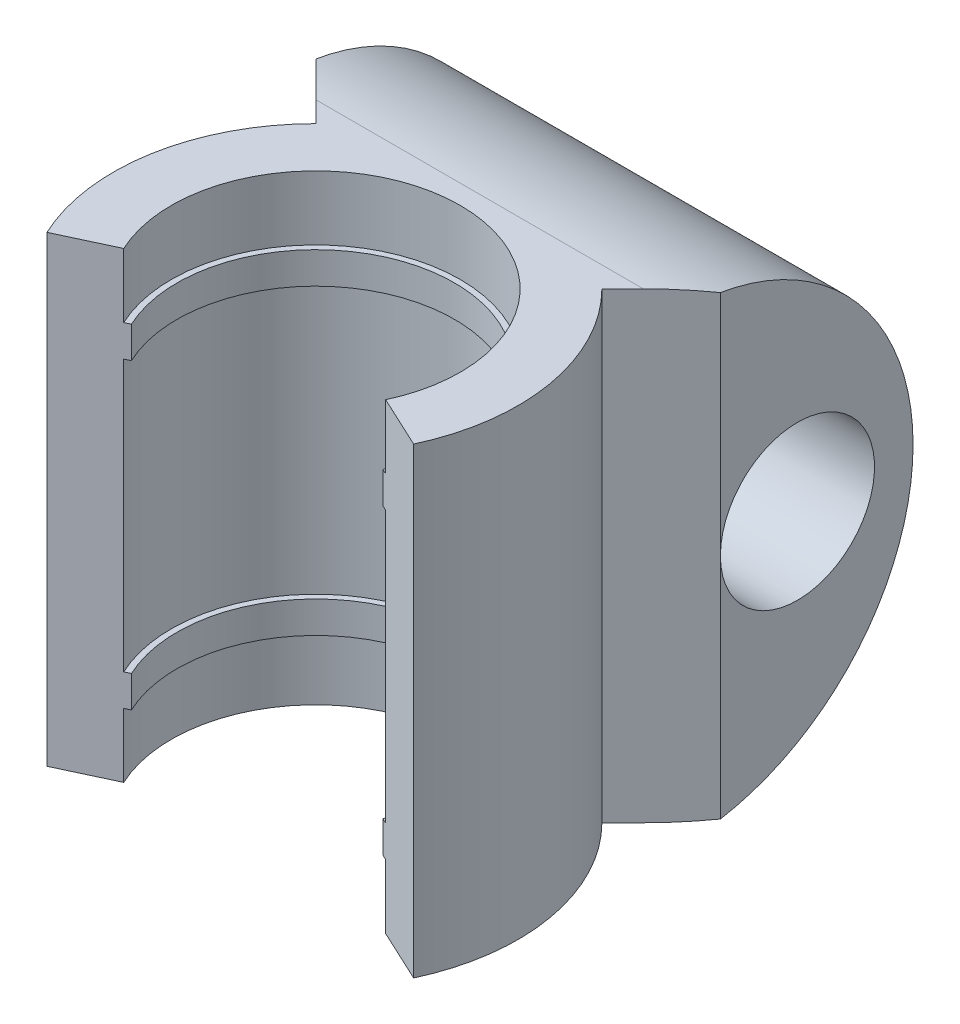
from build123d import *

# Parameters (mm, degrees)
REVOLVE1_ANGLE      = 230
SKETCH2_W           = 21
SKETCH2_H           = 10
BOSS_EXTRUDE1_DEPTH = 24
FILLET1_R           = 12
SKETCH3_R           = 4
CUT_EXTRUDE1_DEPTH  = 38.911080175


with BuildPart() as part:
    # Sketch1 → Revolve1 (revolve, symmetric)
    with BuildSketch(Plane(origin=(0, 0, 0), x_dir=(0, 0, -1), z_dir=(1, 0, 0))) as revolve1_sk:
        Polygon((10.5, 24), (7.5, 24), (7.5, 20.67), (7.2, 20.67), (7.2, 19.03), (7.5, 19.03), (7.5, 4.97), (7.2, 4.97), (7.2, 3.33), (7.5, 3.33), (7.5, 0), (10.5, 0), align=None)
    revolve(axis=Axis((0, -542.901644974, 0), (0, 1, 0)), revolution_arc=REVOLVE1_ANGLE / 2)
    revolve(revolve1_sk.sketch, axis=Axis((0, -542.901644974, 0), (0, -1, 0)), revolution_arc=REVOLVE1_ANGLE / 2)

    # Sketch2 → Boss-Extrude1 (add)
    with BuildSketch(Plane(origin=(0, 24, 0), x_dir=(1, 0, 0), z_dir=(0, 1, 0))):
        with Locations((0, 15.5)):
            Rectangle(SKETCH2_W, SKETCH2_H)
        with BuildLine():
            Line((10.5, 10.5), (1.4e-08, 10.5))
            ThreePointArc((1.4e-08, 10.5), (4.018176046, 9.700735089), (7.424621202, 7.424621202))
            Line((7.424621202, 7.424621202), (10.5, 10.5))
        make_face()
        with BuildLine():
            Line((1.4e-08, 10.5), (-10.5, 10.5))
            Line((-10.5, 10.5), (-7.424621202, 7.424621202))
            ThreePointArc((-7.424621202, 7.424621202), (-4.018176034, 9.700735094), (1.4e-08, 10.5))
        make_face()
    extrude(amount=-BOSS_EXTRUDE1_DEPTH)

    # Fillet1
    fillet1_edges = [part.edges().sort_by_distance(p)[0] for p in [
        (0, 0, -20.5),
        (0, 24, -20.5),
    ]]
    fillet(fillet1_edges, radius=FILLET1_R - 0.0001)  # a hair under: the kernel refuses the full size

    # Sketch3 → Cut-Extrude1 (cut, through all)
    with BuildSketch(Plane.ZY.offset(10.5)):
        with Locations((-14.5, 12)):
            Circle(SKETCH3_R)
    extrude(amount=-CUT_EXTRUDE1_DEPTH, mode=Mode.SUBTRACT)


solid = part.part
